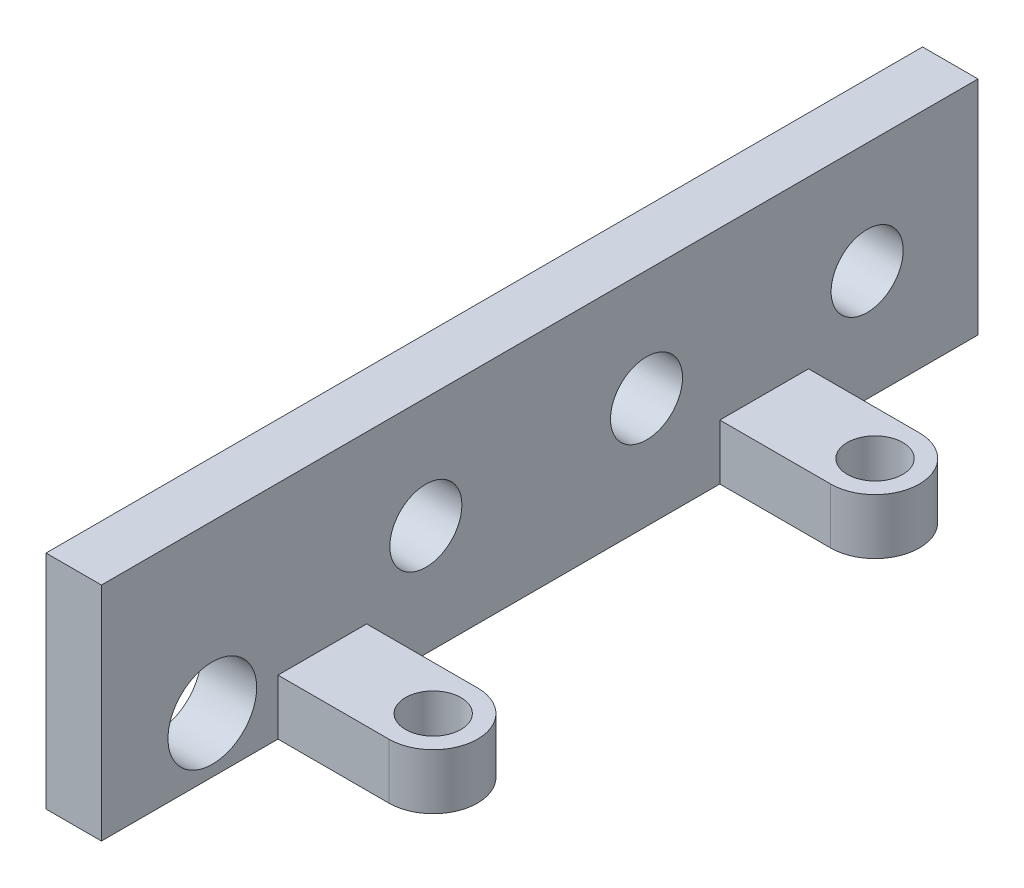
from build123d import *

# Parameters (mm, degrees)
SKETCH1_W           = 79.06161987
SKETCH1_H           = 20
SKETCH1_R           = 3.25
SKETCH1_R_2         = 4
BOSS_EXTRUDE1_DEPTH = 5
SKETCH2_W           = 8
SKETCH2_H           = 5
BOSS_EXTRUDE2_DEPTH = 10
BOSS_EXTRUDE3_DEPTH = 5
SKETCH3_6_R         = 2.5
CUT_EXTRUDE2_DEPTH  = 83.684579798


with BuildPart() as part:
    # Sketch1 → Boss-Extrude1 (new body)
    with BuildSketch(Plane(origin=(0, 0, 0), x_dir=(0, 0, -1), z_dir=(1, 0, 0))):
        with Locations((-39.530809935, 10)):
            Rectangle(SKETCH1_W, SKETCH1_H)
        with Locations((-29.9, 10)):
            Circle(SKETCH1_R, mode=Mode.SUBTRACT)
        with Locations((-49.8, 10)):
            Circle(SKETCH1_R, mode=Mode.SUBTRACT)
        with Locations((-69.06161987, 5)):
            Circle(SKETCH1_R_2, mode=Mode.SUBTRACT)
        with Locations((-10, 10)):
            Circle(SKETCH1_R, mode=Mode.SUBTRACT)
    extrude(amount=BOSS_EXTRUDE1_DEPTH)

    # Sketch2 → Boss-Extrude2 (add)
    with BuildSketch(Plane(origin=(5, 0, 0), x_dir=(0, 0, -1), z_dir=(1, 0, 0))):
        with Locations((-19.28661987, 2.5)):
            Rectangle(SKETCH2_W, SKETCH2_H)
        with Locations((-59.13661987, 2.5)):
            Rectangle(SKETCH2_W, SKETCH2_H)
    extrude(amount=BOSS_EXTRUDE2_DEPTH)

    # Sketch3 → Boss-Extrude3 (add)
    with BuildSketch(Plane(origin=(0, 5, 0), x_dir=(1, 0, 0), z_dir=(0, 1, 0))):
        with BuildLine():
            Line((15, -55.13661987), (15, -63.13661987))
            ThreePointArc((15, -63.13661987), (19, -59.13661987), (15, -55.13661987))
        make_face()
    boss_extrude3 = extrude(amount=-BOSS_EXTRUDE3_DEPTH)

    # Sketch3<6> → Cut-Extrude2 (cut, through all)
    with BuildSketch(Plane(origin=(0, 5, 0), x_dir=(1, 0, 0), z_dir=(0, 1, 0))):
        with Locations((15, -59.13661987)):
            Circle(SKETCH3_6_R)
    cut_extrude2 = extrude(amount=-CUT_EXTRUDE2_DEPTH, mode=Mode.SUBTRACT)

    # Mirror1: Boss-Extrude3, Cut-Extrude2 across plane
    add(boss_extrude3.mirror(Plane.XY.offset(39.21161987)))
    add(cut_extrude2.mirror(Plane.XY.offset(39.21161987)), mode=Mode.SUBTRACT)


solid = part.part
